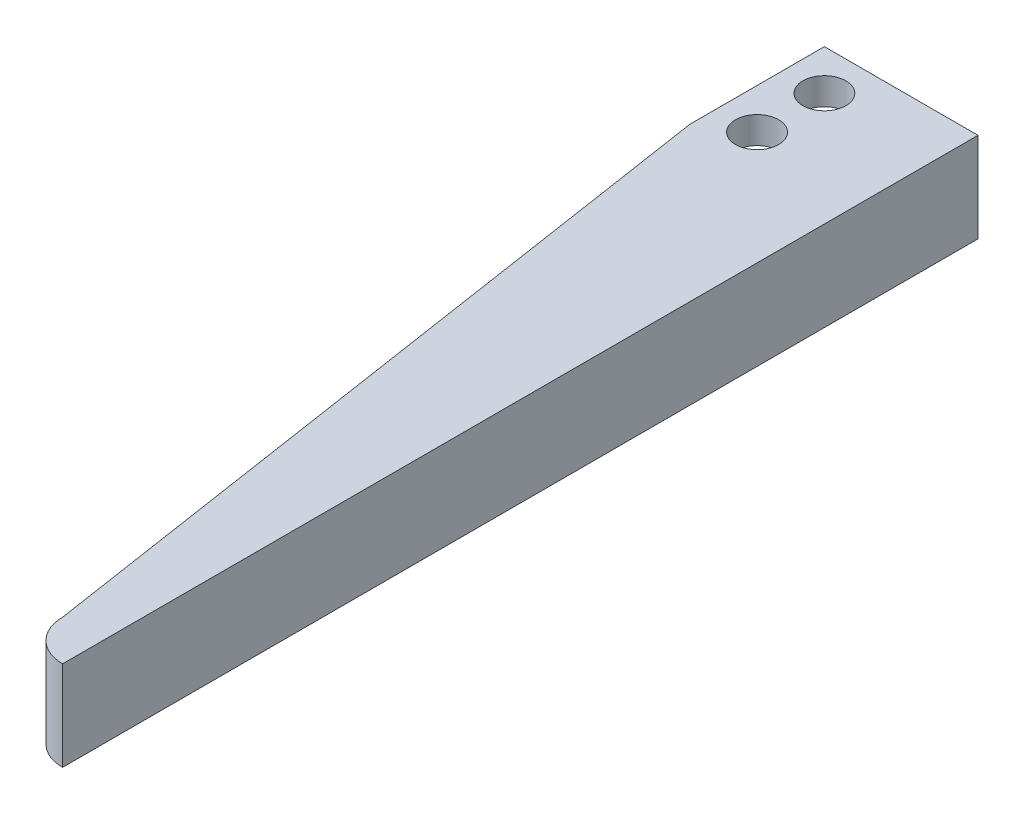
from build123d import *

# Parameters (mm, degrees)
SKETCH1_R           = 1.6
BOSS_EXTRUDE1_DEPTH = 2
BOSS_EXTRUDE2_START = 4.6625
BOSS_EXTRUDE2_DEPTH = 4.6625


with BuildPart() as part:
    # Sketch1 → Boss-Extrude1 (new body)
    with BuildSketch(Plane(origin=(0, 0, 0), x_dir=(1, 0, 0), z_dir=(0, 1, 0))):
        with BuildLine():
            Line((-5.70625, 0), (5.70625, 0))
            Line((5.70625, 0), (5.70625, -68))
            ThreePointArc((5.70625, -68), (3.584929656, -67.121320344), (2.70625, -65))
            Line((2.70625, -65), (-5.70625, -10))
            Line((-5.70625, -10), (-5.70625, 0))
        make_face()
        with Locations((-2.70625, -3)):
            Circle(SKETCH1_R, mode=Mode.SUBTRACT)
        with Locations((-2.70625, -8)):
            Circle(SKETCH1_R, mode=Mode.SUBTRACT)
    extrude(amount=BOSS_EXTRUDE1_DEPTH)

    # Sketch2 → Boss-Extrude2 (add)
    with BuildSketch(Plane.XZ.offset(BOSS_EXTRUDE2_START)):
        with BuildLine():
            Line((5.70625, 68), (5.70625, 0))
            Line((5.70625, 0), (2.70625, 0))
            Line((2.70625, 0), (2.70625, 65))
            ThreePointArc((2.70625, 65), (3.584929656, 67.121320344), (5.70625, 68))
        make_face()
    extrude(amount=-BOSS_EXTRUDE2_DEPTH)


solid = part.part
